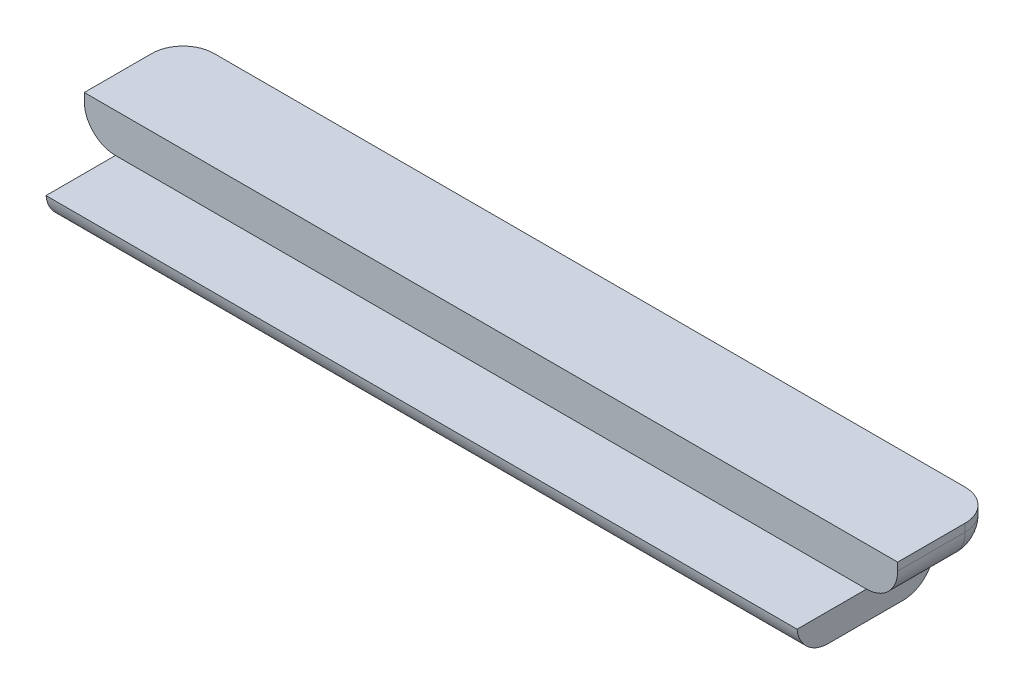
from build123d import *

# Parameters (mm, degrees)
SKETCH1_W           = 52.200247598
SKETCH1_H           = 6.332152384
BOSS_EXTRUDE1_DEPTH = 2.5
FILLET1_R           = 2
FILLET2_R           = 2
SKETCH4_W           = 48.201423078
SKETCH4_H           = 8.78902621
BOSS_EXTRUDE2_DEPTH = 1.8
FILLET3_R           = 2
FILLET4_R           = 2


with BuildPart() as part:
    # Sketch1 → Boss-Extrude1 (new body)
    with BuildSketch(Plane(origin=(0, -35, 0), x_dir=(1, 0, 0), z_dir=(0, 1, 0))):
        with Locations((60.097811714, 35.152469917)):
            Rectangle(SKETCH1_W, SKETCH1_H)
    extrude(amount=-BOSS_EXTRUDE1_DEPTH)

    # Fillet1
    fillet1_edges = [part.edges().sort_by_distance(p)[0] for p in [
        (60.097811714, -37.5, -38.318546109),
    ]]
    fillet(fillet1_edges, radius=FILLET1_R)

    # Fillet2
    fillet2_edges = [part.edges().sort_by_distance(p)[0] for p in [
        (86.197935513, -37.5, -34.152469917),
        (86.197935513, -35.25, -38.318546109),
        (33.997687915, -35.25, -38.318546109),
        (33.997687915, -37.5, -34.152469917),
        (33.997687915, -36.914213562, -37.732759671),
        (86.197935513, -36.914213562, -37.732759671),
    ]]
    fillet(fillet2_edges, radius=FILLET2_R)


with BuildPart() as boss_extrude2_tool:
    # Sketch4 → Boss-Extrude2 (new body)
    with BuildSketch(Plane.XZ.offset(37.5)):
        with Locations((60.098399454, -31.924033004)):
            Rectangle(SKETCH4_W, SKETCH4_H)
    extrude(amount=BOSS_EXTRUDE2_DEPTH)


with BuildPart() as part_1:
    add(part.part)


with BuildPart() as part_2:
    # Boss-Extrude2: joined with boss_extrude2_tool
    add(part_1.part.fuse(boss_extrude2_tool.part, tol=0.00001))

    # Fillet3
    # the kernel refuses this fillet: 2 mm, written as the material it takes off along each edge
    with BuildSketch(Plane(origin=(89.174048179, -39.3, -27.529519899), x_dir=(0, 0, -1), z_dir=(-1, 0, 0))) as fillet3_piece_1:
        with BuildLine():
            CenterArc((1.989974874, -2), FILLET3_R, 90, 84.260829523)
            Line((0, -1.8), (-0.039799497, -1.796))
            ThreePointArc((-0.039799497, -1.796), (-0.04, -0.9), (-0.04, 0))
            Line((-0.04, 0), (0, 0.04))
            Line((0, 0.04), (1.989974874, 0.04))
            Line((1.989974874, 0.04), (1.989974874, 0))
        make_face()
    extrude(amount=58.151297449, mode=Mode.SUBTRACT)

    # Fillet4
    # the kernel refuses this fillet: 2 mm, written as the material it takes off along each edge
    with BuildSketch(Plane(origin=(31.02275073, -39.3, -36.318546109), x_dir=(0, 1, 0), z_dir=(1, 0, 0))) as fillet4_piece_1:
        with BuildLine():
            CenterArc((2, 1.989974874), FILLET4_R, 180, 84.260829523)
            Line((0, 1.989974874), (-0.04, 1.989974874))
            Line((-0.04, 1.989974874), (-0.04, 0))
            Line((-0.04, 0), (0, -0.04))
            ThreePointArc((0, -0.04), (0.9, -0.04), (1.796, -0.039799497))
            Line((1.796, -0.039799497), (1.8, 0))
        make_face()
    extrude(amount=58.151297449, mode=Mode.SUBTRACT)


solid = part_2.part
